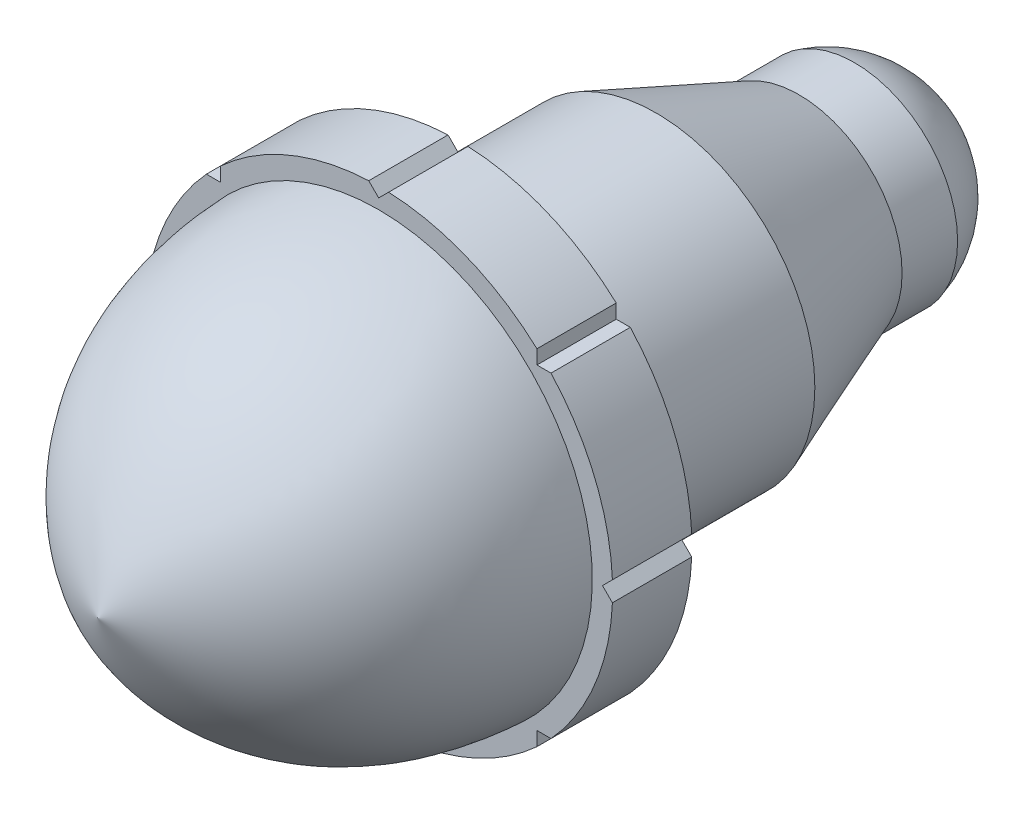
from build123d import *

# Parameters (mm, degrees)
DOME1_FACE_RADIUS = 3.302
DOME1_HEIGHT      = 2.54
SEEDCUT_DEPTH     = 21.698272826
CIRPATTERN1_COUNT = 8


# Read off the part's stored shape, not the designer's step: Cut-Revolve-Thin3
with BuildPart() as part:
    # Sketch1 → Revolve1 (revolve)
    with BuildSketch(Plane(origin=(0, 0, 0), x_dir=(0, 0, -1), z_dir=(1, 0, 0)), mode=Mode.PRIVATE) as revolve1_sk:
        Polygon((-2.54, 0), (-2.54, 7.493), (0, 7.493), (0, 5.08), (12.7, 5.08), (12.7, 0), align=None)
    revolve(revolve1_sk.sketch.rotate(Axis((0, 0, 9.999244512), (0, 0, -1)), 90), axis=Axis((0, 0, 9.999244512), (0, 0, -1)))

    # Sketch2 → Revolve2 (revolve)
    with BuildSketch(Plane(origin=(0, 0, 0), x_dir=(0, 0, -1), z_dir=(1, 0, 0))):
        with BuildLine():
            Line((-11.531198063, 0), (-2.54, 0))
            Line((-2.54, 0), (-2.54, 6.84268102))
            add(Edge.make_bspline(
                [(-2.54, 6.84268102), (-9.189579749, 6.525332983), (-11.531198063, 0)],
                knots=[0, 0, 0, 1, 1, 1], degree=2))
        make_face()
    revolve(axis=Axis((0, 0, 9.999244512), (0, 0, 1)))

    # Cut-Revolve-Thin3 outline → Cut-Revolve-Thin3 (revolve, cut)
    with BuildSketch(Plane.XZ):
        Polygon((3.302, -10.922), (3.302, -12.7), (5.08, -12.7), (5.08, -6.35), align=None)
    revolve(axis=Axis((0, 0, 0), (0, 0, 1)), mode=Mode.SUBTRACT)

    # Dome1: a dome of height H over a round flat face of radius A is a cap of a sphere of radius (A * A + H * H) / (2 * H)
    dome1_r = (DOME1_FACE_RADIUS * DOME1_FACE_RADIUS + DOME1_HEIGHT * DOME1_HEIGHT) / (2 * DOME1_HEIGHT)
    dome1_base = Plane((0, 0, -12.7), z_dir=(0, 0, -1))
    with Locations(dome1_base.offset(DOME1_HEIGHT - dome1_r)):
        dome1_ball = Sphere(dome1_r, mode=Mode.PRIVATE)
    add(split(dome1_ball, bisect_by=dome1_base, keep=Keep.TOP, mode=Mode.PRIVATE))

    # Sketch4 → SeedCut (cut, through all)
    with BuildSketch(Plane.XY.offset(2.54)):
        with BuildLine():
            Line((0, 7.16784051), (-0.318391894, 7.486232404))
            ThreePointArc((-0.318391894, 7.486232404), (0, 7.493), (0.318391894, 7.486232404))
            Line((0.318391894, 7.486232404), (0, 7.16784051))
        make_face()
    seedcut = extrude(amount=-SEEDCUT_DEPTH, mode=Mode.SUBTRACT)

    # CirPattern1: SeedCut ×8 about axis
    cirpattern1_axis = Axis((0, 0, 0), (0, 0, 1))
    for i in range(1, CIRPATTERN1_COUNT):
        add(seedcut.rotate(cirpattern1_axis, i * 360 / CIRPATTERN1_COUNT), mode=Mode.SUBTRACT)


solid = part.part
